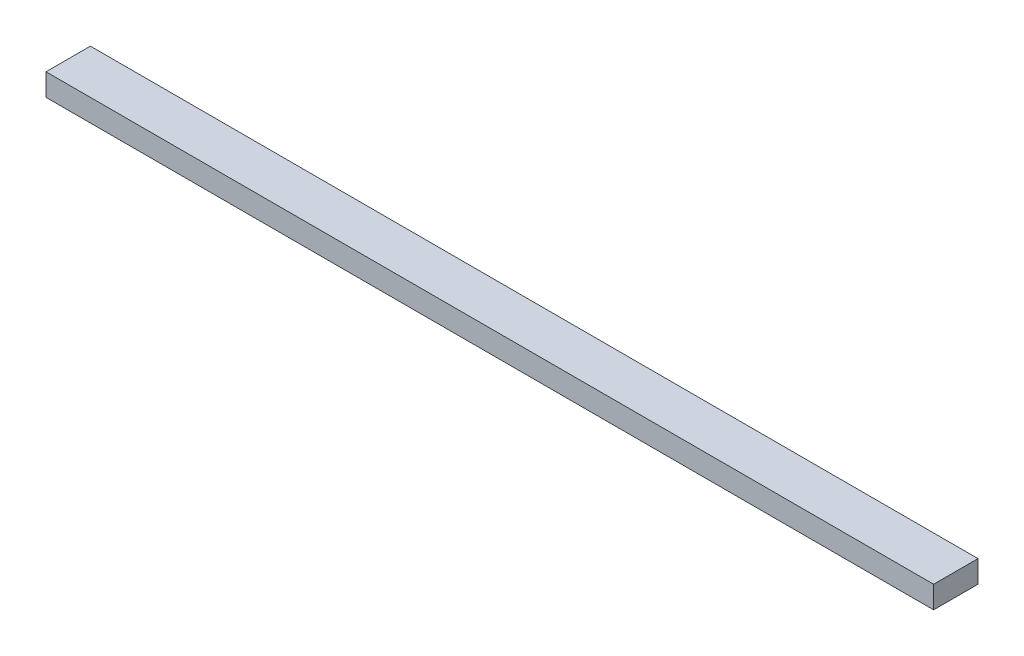
from build123d import *

# Parameters (mm, degrees)
SKETCH1_W           = 254
SKETCH1_H           = 6.35
BOSS_EXTRUDE1_DEPTH = 12.7


with BuildPart() as part:
    # Sketch1 → Boss-Extrude1 (new body)
    with BuildSketch(Plane.XY):
        Rectangle(SKETCH1_W, SKETCH1_H)
    extrude(amount=BOSS_EXTRUDE1_DEPTH)


solid = part.part
